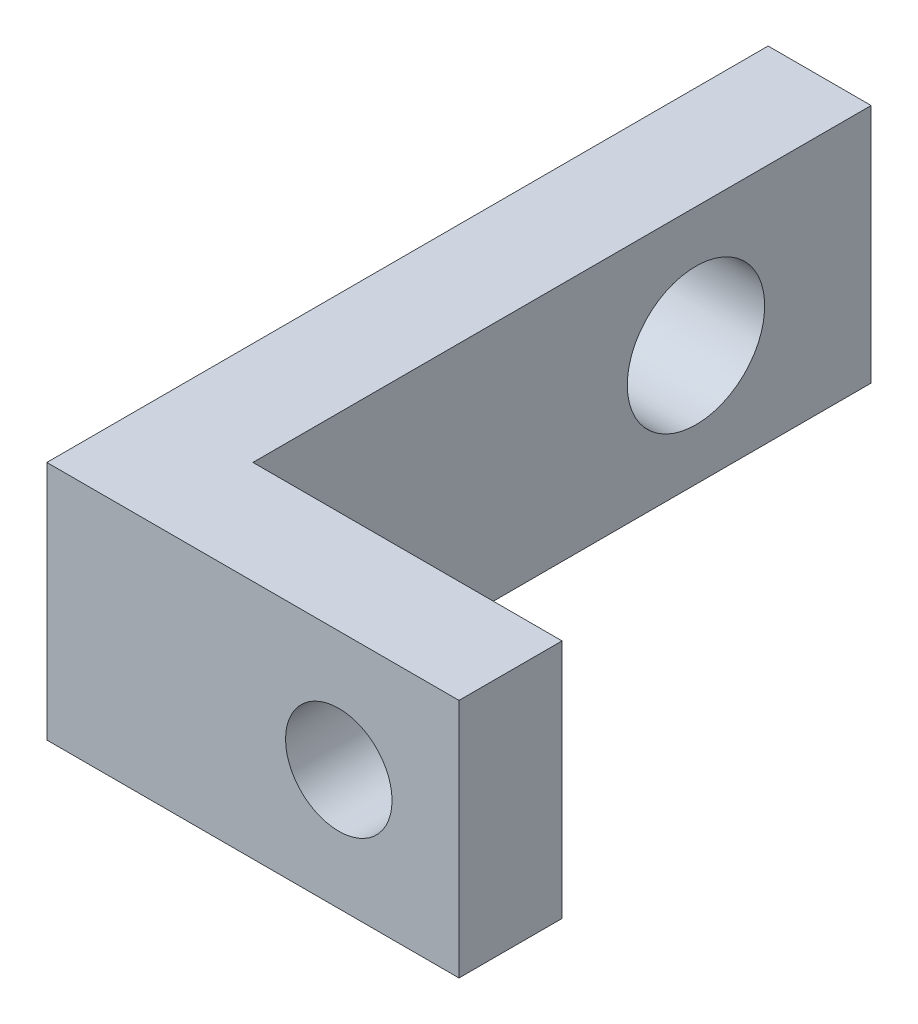
from build123d import *

# Parameters (mm, degrees)
SKETCH1_W           = 132
SKETCH1_H           = 160
BOSS_EXTRUDE1_DEPTH = 6
SKETCH3_W           = 32
SKETCH3_H           = 54
SKETCH3_W_2         = 26
SKETCH3_H_2         = 48
BOSS_EXTRUDE2_DEPTH = 17.5
SKETCH4_W           = 32
SKETCH4_H           = 54
BOSS_EXTRUDE3_DEPTH = 3
SKETCH5_W           = 25
SKETCH5_H           = 17
CUT_EXTRUDE1_DEPTH  = 3
SKETCH6_W           = 12
SKETCH6_H           = 54
BOSS_EXTRUDE4_DEPTH = 3
SKETCH7_R           = 1.6
CUT_EXTRUDE2_DEPTH  = 106.177231376
SKETCH8_W           = 3
SKETCH8_H           = 6.5
BOSS_EXTRUDE5_DEPTH = 20
SKETCH9_R           = 1.55
CUT_EXTRUDE3_DEPTH  = 6
SKETCH10_R          = 1.6
CUT_EXTRUDE4_DEPTH  = 108.043215572
SKETCH11_W          = 2.5
SKETCH11_H          = 7
BOSS_EXTRUDE6_DEPTH = 19.36
SKETCH12_R          = 1.6
CUT_EXTRUDE5_DEPTH  = 19.36
SKETCH13_W          = 3
SKETCH13_H          = 7
BOSS_EXTRUDE7_DEPTH = 15
SKETCH14_R          = 2
CUT_EXTRUDE6_DEPTH  = 15
CUT_EXTRUDE7_START  = -6
CUT_EXTRUDE7_DEPTH  = 6
SKETCH16_R          = 1.6
CUT_EXTRUDE8_DEPTH  = 15
CUT_EXTRUDE9_DEPTH  = 69
SKETCH18_W          = 9
SKETCH18_H          = 3
CUT_EXTRUDE10_DEPTH = 69
SKETCH19_R          = 1.55
CUT_EXTRUDE11_DEPTH = 69


# Read off the part's stored shape, not the designer's step: Cut-Extrude7
with BuildPart() as part:
    # Sketch1 → Boss-Extrude1 (new body)
    with BuildSketch(Plane.XY):
        Rectangle(SKETCH1_W, SKETCH1_H)
    extrude(amount=BOSS_EXTRUDE1_DEPTH)

    # Sketch3 → Boss-Extrude2 (add)
    with BuildSketch(Plane.XY.offset(6)):
        with Locations((0, -53)):
            Rectangle(SKETCH3_W, SKETCH3_H)
        with Locations((0, -53)):
            Rectangle(SKETCH3_W_2, SKETCH3_H_2, mode=Mode.SUBTRACT)
    extrude(amount=BOSS_EXTRUDE2_DEPTH)

    # Sketch4 → Boss-Extrude3 (add)
    with BuildSketch(Plane.XY.offset(23.5)):
        with Locations((0, -53)):
            Rectangle(SKETCH4_W, SKETCH4_H)
    extrude(amount=BOSS_EXTRUDE3_DEPTH)

    # Sketch5 → Cut-Extrude1 (cut)
    with BuildSketch(Plane.XZ.offset(80)):
        with Locations((0, 14.5)):
            Rectangle(SKETCH5_W, SKETCH5_H)
    extrude(amount=-CUT_EXTRUDE1_DEPTH, mode=Mode.SUBTRACT)

    # Sketch6 → Boss-Extrude4 (add)
    with BuildSketch(Plane.XY.offset(6)):
        with Locations((-22, -53)):
            Rectangle(SKETCH6_W, SKETCH6_H)
        with Locations((22, -53)):
            Rectangle(SKETCH6_W, SKETCH6_H)
    extrude(amount=BOSS_EXTRUDE4_DEPTH)

    # Sketch7 → Cut-Extrude2 (cut, through all)
    with BuildSketch(Plane.XY.offset(9)):
        with Locations((-22, -69)):
            Circle(SKETCH7_R)
        with Locations((-22, -33)):
            Circle(SKETCH7_R)
        with Locations(Location((22, -69, 0), (0, 0, 180))):
            Circle(SKETCH7_R)
        with Locations(Location((22, -33, 0), (0, 0, 180))):
            Circle(SKETCH7_R)
    extrude(amount=-CUT_EXTRUDE2_DEPTH, mode=Mode.SUBTRACT)

    # Sketch8 → Boss-Extrude5 (add)
    with BuildSketch(Plane.XY.offset(6)):
        with Locations((-54.38, -76.75)):
            Rectangle(SKETCH8_W, SKETCH8_H)
        with Locations((-54.38, -30.25)):
            Rectangle(SKETCH8_W, SKETCH8_H)
    boss_extrude5 = extrude(amount=BOSS_EXTRUDE5_DEPTH)

    # Sketch9 → Cut-Extrude3 (cut)
    with BuildSketch(Plane.ZY.offset(55.88)):
        with Locations((10.35, -76.75)):
            Circle(SKETCH9_R)
        with Locations((19.65, -76.75)):
            Circle(SKETCH9_R)
        with Locations((10.35, -30.25)):
            Circle(SKETCH9_R)
        with Locations((19.65, -30.25)):
            Circle(SKETCH9_R)
    cut_extrude3 = extrude(amount=-CUT_EXTRUDE3_DEPTH, mode=Mode.SUBTRACT)

    # Mirror1: Boss-Extrude5, Cut-Extrude3 across plane
    add(boss_extrude5.mirror(Plane(origin=(0, 0, 0), x_dir=(0, 0, 1), z_dir=(1, 0, 0))))
    add(cut_extrude3.mirror(Plane(origin=(0, 0, 0), x_dir=(0, 0, 1), z_dir=(1, 0, 0))), mode=Mode.SUBTRACT)

    # Sketch10 → Cut-Extrude4 (cut, through all)
    with BuildSketch(Plane(origin=(0, 0, 0), x_dir=(-1, 0, 0), z_dir=(0, 0, -1))):
        with Locations((-24.1, -75.572749788)):
            Circle(SKETCH10_R)
        with Locations((-21.15, -12.732749788)):
            Circle(SKETCH10_R)
        with Locations(Location((21.15, -12.732749788, 0), (0, 0, 180))):
            Circle(SKETCH10_R)
        with Locations((24.1, -75.572749788)):
            Circle(SKETCH10_R)
    extrude(amount=-CUT_EXTRUDE4_DEPTH, mode=Mode.SUBTRACT)

    # Sketch11 → Boss-Extrude6 (add)
    with BuildSketch(Plane(origin=(0, 0, 0), x_dir=(-1, 0, 0), z_dir=(0, 0, -1))):
        with Locations((-17.9, 1.267250212)):
            Rectangle(SKETCH11_W, SKETCH11_H)
        with Locations((-17.9, 50.267250212)):
            Rectangle(SKETCH11_W, SKETCH11_H)
    extrude(amount=BOSS_EXTRUDE6_DEPTH)

    # Sketch12 → Cut-Extrude5 (cut)
    with BuildSketch(Plane(origin=(19.15, 0, 0), x_dir=(0, 0, -1), z_dir=(1, 0, 0))):
        with Locations(Location((4.5, 50.267250212, 0), (0, 0, 90))):
            Circle(SKETCH12_R)
        with Locations(Location((14.5, 50.267250212, 0), (0, 0, 90))):
            Circle(SKETCH12_R)
        with Locations(Location((4.5, 1.267250212, 0), (0, 0, 90))):
            Circle(SKETCH12_R)
        with Locations(Location((14.5, 1.267250212, 0), (0, 0, 90))):
            Circle(SKETCH12_R)
    extrude(amount=-CUT_EXTRUDE5_DEPTH, mode=Mode.SUBTRACT)

    # Sketch13 → Boss-Extrude7 (add)
    with BuildSketch(Plane(origin=(0, 0, 0), x_dir=(-1, 0, 0), z_dir=(0, 0, -1))):
        with Locations((29.35, 35.967250212)):
            Rectangle(SKETCH13_W, SKETCH13_H)
    extrude(amount=BOSS_EXTRUDE7_DEPTH)

    # Sketch14 → Cut-Extrude6 (cut)
    with BuildSketch(Plane.ZY.offset(30.85)):
        with Locations((-9.9, 35.967250212)):
            Circle(SKETCH14_R)
    extrude(amount=-CUT_EXTRUDE6_DEPTH, mode=Mode.SUBTRACT)

    # Cut-Extrude7 outline → Cut-Extrude7 (cut)
    with BuildSketch(Plane(origin=(0, 0, 0), x_dir=(-1, 0, 0), z_dir=(0, 0, -1)).offset(CUT_EXTRUDE7_START)):
        Polygon((-30.85, 56.767250212), (30.85, 56.767250212), (30.85, -24), (58.88, -24), (58.88, -80), (66, -80), (66, 80), (-66, 80), (-66, -80), (-58.88, -80), (-58.88, -24), (-30.85, -24), align=None)
    extrude(amount=CUT_EXTRUDE7_DEPTH, mode=Mode.SUBTRACT)

    # Sketch16 → Cut-Extrude8 (cut)
    with BuildSketch(Plane(origin=(0, 0, 0), x_dir=(-1, 0, 0), z_dir=(0, 0, -1))):
        Circle(SKETCH16_R)
        with Locations((0, 52.767250212)):
            Circle(SKETCH16_R)
    extrude(amount=-CUT_EXTRUDE8_DEPTH, mode=Mode.SUBTRACT)

    # Sketch17 → Cut-Extrude9 (cut)
    with BuildSketch(Plane(origin=(0, 0, 0), x_dir=(-1, 0, 0), z_dir=(0, 0, -1))):
        Polygon((-30.85, 56.767250212), (30.85, 56.767250212), (30.85, 39.467250212), (18.85, 39.467250212), (18.85, 32.467250212), (30.85, 32.467250212), (58.88, -24), (58.88, -80), (-58.88, -80), (-58.88, 56.767250212), align=None)
    extrude(amount=-CUT_EXTRUDE9_DEPTH, mode=Mode.SUBTRACT)


with BuildPart() as body_2:
    # of the pieces the cut leaves, the one that is kept (cut_extrude9_keep)
    add(part.part.solids().sort_by_distance((-27.85, 39.467250212, 0))[0])

    # Sketch18 → Cut-Extrude10 (cut)
    with BuildSketch(Plane.XZ.offset(-32.467250212)):
        with Locations((-23.35, 1.5)):
            Rectangle(SKETCH18_W, SKETCH18_H)
    extrude(amount=-CUT_EXTRUDE10_DEPTH, mode=Mode.SUBTRACT)

    # Sketch19 → Cut-Extrude11 (cut)
    with BuildSketch(Plane(origin=(0, 0, 3), x_dir=(-1, 0, 0), z_dir=(0, 0, -1))):
        with Locations((22.35, 35.967250212)):
            Circle(SKETCH19_R)
    extrude(amount=-CUT_EXTRUDE11_DEPTH, mode=Mode.SUBTRACT)


solid = body_2.part
